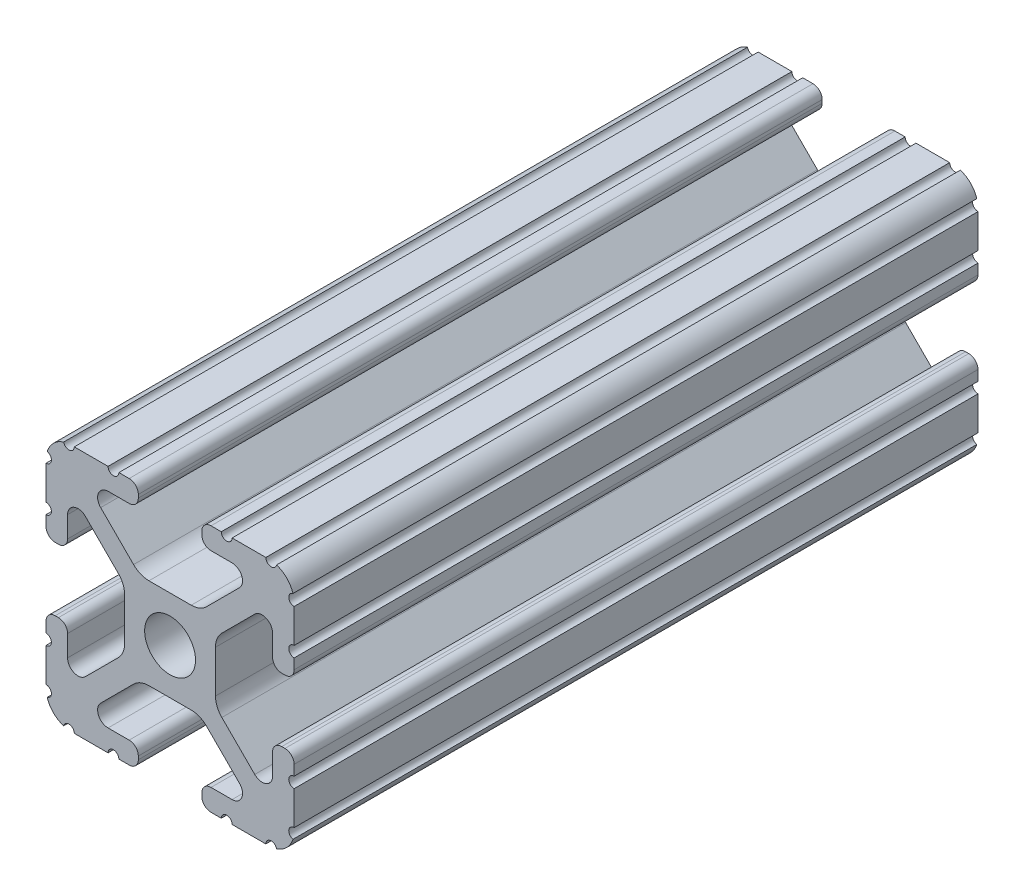
from build123d import *

# Parameters (mm, degrees)
BOSS_EXTRUDE1_DEPTH     = 35
CUT_EXTRUDE1_DEPTH      = 40.339293334
CUT_EXTRUDE1_DEPTH_BACK = 40.339293334
SKETCH5_R               = 0.55245
CUT_EXTRUDE2_DEPTH      = 40.339293334
CUT_EXTRUDE2_DEPTH_BACK = 40.339293334
SKETCH6_R               = 2.555
CUT_EXTRUDE3_DEPTH      = 40.339293423
CUT_EXTRUDE3_DEPTH_BACK = 40.339293423
SKETCH7_R               = 2.54


with BuildPart() as part:
    # Sketch4 → Boss-Extrude1 (new, symmetric)
    with BuildSketch(Plane.XY):
        with BuildLine():
            Line((4.190365, -12.7), (10.11729625, -12.7))
            ThreePointArc((10.11729625, -12.7), (11.943543585, -11.943543585), (12.7, -10.11729625))
            Line((12.7, -10.11729625), (12.7, -4.190365))
            ThreePointArc((12.7, -4.190365), (12.42492494, -3.52627506), (11.760835, -3.2512))
            Line((11.760835, -3.2512), (11.429365, -3.2512))
            ThreePointArc((11.429365, -3.2512), (10.76527506, -3.52627506), (10.4902, -4.190365))
            Line((10.4902, -4.190365), (10.4902, -6.348478019))
            ThreePointArc((10.4902, -6.348478019), (9.830707141, -7.335478831), (8.666460301, -7.103895736))
            Line((8.666460301, -7.103895736), (5.299899128, -3.737334563))
            ThreePointArc((5.299899128, -3.737334563), (4.817571085, -3.015479634), (4.6482, -2.16399369))
            Line((4.6482, -2.16399369), (4.6482, 0))
            Line((4.6482, 0), (2.6035, 0))
            ThreePointArc((2.6035, 0), (1.840952505, -1.840952505), (0, -2.6035))
            Line((0, -2.6035), (0, -4.6482))
            Line((0, -4.6482), (2.16399369, -4.6482))
            ThreePointArc((2.16399369, -4.6482), (3.015479634, -4.817571085), (3.737334563, -5.299899128))
            Line((3.737334563, -5.299899128), (7.103895736, -8.666460301))
            ThreePointArc((7.103895736, -8.666460301), (7.335478831, -9.830707141), (6.348478019, -10.4902))
            Line((6.348478019, -10.4902), (4.190365, -10.4902))
            ThreePointArc((4.190365, -10.4902), (3.52627506, -10.76527506), (3.2512, -11.429365))
            Line((3.2512, -11.429365), (3.2512, -11.760835))
            ThreePointArc((3.2512, -11.760835), (3.52627506, -12.42492494), (4.190365, -12.7))
        make_face()
    extrude(amount=BOSS_EXTRUDE1_DEPTH, both=True)

    # Sketch5 → Cut-Extrude1 (cut, two sides: drawn at the far end of the back side and taken through both)
    with BuildSketch(Plane.XY.offset(-CUT_EXTRUDE1_DEPTH_BACK)):
        with Locations((10.356153152, -12.7)):
            Circle(SKETCH5_R)
        with Locations((5.796028019, -12.7)):
            Circle(SKETCH5_R)
        with Locations((12.7, -10.356153152)):
            Circle(SKETCH5_R)
        with Locations((12.7, -5.796028019)):
            Circle(SKETCH5_R)
    extrude(amount=CUT_EXTRUDE1_DEPTH + CUT_EXTRUDE1_DEPTH_BACK, mode=Mode.SUBTRACT)

    # Mirror1: part across plane


with BuildPart() as part_1:
    add(part.part)
    add(part.part.mirror(Plane(origin=(0, 0, 0), x_dir=(0, 0, 1), z_dir=(1, 0, 0))))

    # Mirror2: part across plane


with BuildPart() as part_2:
    add(part_1.part)
    add(part_1.part.mirror(Plane.ZX))

    # Sketch6 → Cut-Extrude2 (cut, two sides: drawn at the far end of the back side and taken through both)
    with BuildSketch(Plane(origin=(0, 0, 0), x_dir=(1, 0, 0), z_dir=(0, 1, 0)).offset(-CUT_EXTRUDE2_DEPTH_BACK)):
        with Locations((0, -22.3)):
            Circle(SKETCH6_R)
        with Locations((0, 22.3)):
            Circle(SKETCH6_R)
    extrude(amount=CUT_EXTRUDE2_DEPTH + CUT_EXTRUDE2_DEPTH_BACK, mode=Mode.SUBTRACT)

    # Sketch7 → Cut-Extrude3 (cut, two sides: drawn at the far end of the back side and taken through both)
    with BuildSketch(Plane(origin=(0, 0, 0), x_dir=(0, 0, -1), z_dir=(1, 0, 0)).offset(-CUT_EXTRUDE3_DEPTH_BACK)):
        with Locations((9.6, 0)):
            Circle(SKETCH7_R)
        with Locations((-9.6, 0)):
            Circle(SKETCH7_R)
    extrude(amount=CUT_EXTRUDE3_DEPTH + CUT_EXTRUDE3_DEPTH_BACK, mode=Mode.SUBTRACT)


solid = part_2.part
